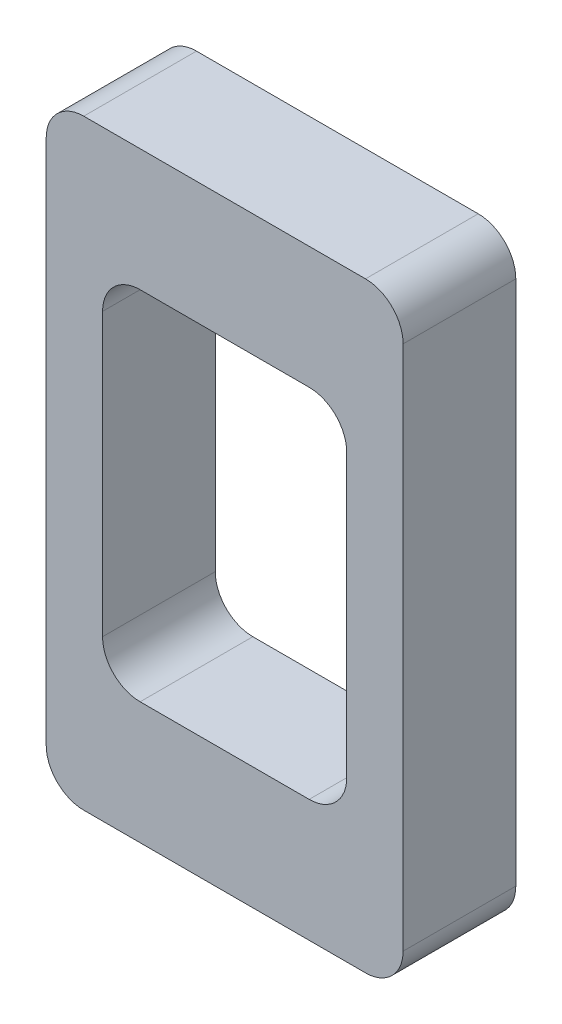
from build123d import *

# Parameters (mm, degrees)
ESQUISSE1_W      = 9.5
ESQUISSE1_H      = 16
ESQUISSE1_W_2    = 6.5
ESQUISSE1_H_2    = 9.5
EXTRUSION1_DEPTH = 3
CONG_1_R         = 1


with BuildPart() as part:
    # Esquisse1 → Extrusion1 (new body)
    with BuildSketch(Plane.XY):
        with Locations((-55.8, 37.58978076)):
            Rectangle(ESQUISSE1_W, ESQUISSE1_H)
        with Locations((-55.8, 37.58978076)):
            Rectangle(ESQUISSE1_W_2, ESQUISSE1_H_2, mode=Mode.SUBTRACT)
    extrude(amount=EXTRUSION1_DEPTH)

    # Congé1
    cong_1_edges = [part.edges().sort_by_distance(p)[0] for p in [
        (-60.55, 29.58978076, 1.5),
        (-60.55, 45.58978076, 1.5),
        (-51.05, 29.58978076, 1.5),
        (-51.05, 45.58978076, 1.5),
        (-52.55, 32.83978076, 1.5),
        (-59.05, 32.83978076, 1.5),
        (-59.05, 42.33978076, 1.5),
        (-52.55, 42.33978076, 1.5),
    ]]
    fillet(cong_1_edges, radius=CONG_1_R)


solid = part.part
